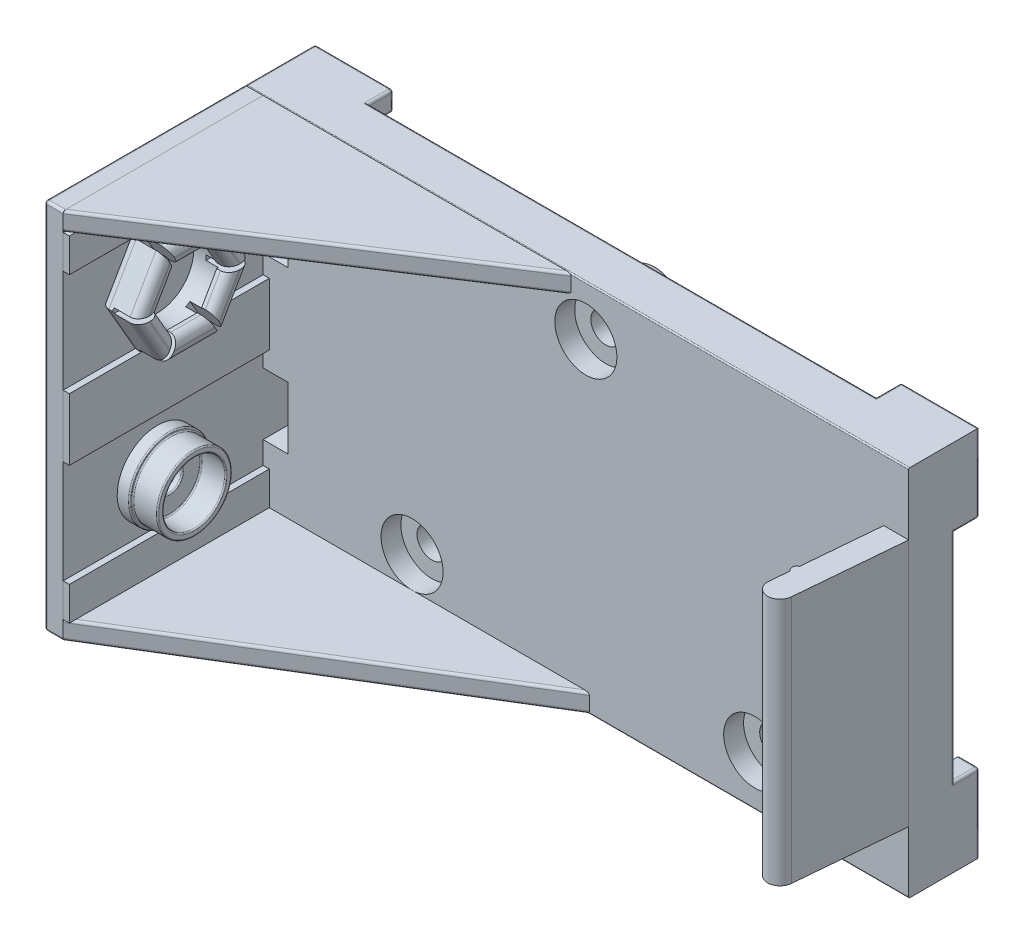
from build123d import *

# Parameters (mm, degrees)
IZIM3_W                                  = 53.5
IZIM3_H                                  = 30
Y_KSEKLIK_EKSTR_ZYON1_DEPTH              = 3.7
Y_KSEKLIK_EKSTR_ZYON2_DEPTH              = 2
IZIM5_W                                  = 1.5
IZIM5_H                                  = 30
Y_KSEKLIK_EKSTR_ZYON3_DEPTH              = 16.1
Y_KSEKLIK_EKSTR_ZYON4_DEPTH              = 1.5
Y_KSEKLIK_EKSTR_ZYON6_DEPTH              = 1.5
Y_KSEKLIK_EKSTR_ZYON9_DEPTH              = 30
IZIM9_W                                  = 10.662770755
IZIM9_H                                  = 5
IZIM9_W_2                                = 11.407729848
KES_EKSTR_ZYON1_DEPTH                    = 10
IZIM10_R                                 = 3.8
KES_EKSTR_ZYON2_DEPTH                    = 0.5
IZIM11_R                                 = 1
KES_EKSTR_ZYON3_DEPTH                    = 3
M2_YASS_BA_L_MAKINE_VIDAS_IN_HAV_2_COUNT = 2
M2_YASS_BA_L_MAKINE_VIDAS_IN_HAV_2_PITCH = 25.864261057
M2_YASS_BA_L_MAKINE_VIDAS_IN_HAV_3_COUNT = 2
M2_YASS_BA_L_MAKINE_VIDAS_IN_HAV_3_PITCH = 26.076809621
IZIM14_R                                 = 2.4
IZIM14_R_2                               = 1.2
Y_KSEKLIK_EKSTR_ZYON10_DEPTH             = 2
RADYUS2_R                                = 0.5
Y_KSEKLIK_EKSTR_ZYON13_DEPTH             = 16.1
IZIM17_W                                 = 0.5
IZIM17_H                                 = 2.7
Y_KSEKLIK_EKSTR_ZYON16_DEPTH             = 16.1
Y_KSEKLIK_EKSTR_ZYON16_2_DEPTH           = 16.1
IZIM18_R                                 = 3.25
Y_KSEKLIK_EKSTR_ZYON17_DEPTH             = 1
IZIM19_R                                 = 3
IZIM19_R_2                               = 2.5
Y_KSEKLIK_EKSTR_ZYON19_DEPTH             = 2
IZIM20_R                                 = 1
KES_EKSTR_ZYON4_DEPTH                    = 4
RADYUS3_R                                = 0.1
IZIM22_W                                 = 2
IZIM22_H                                 = 5
KES_EKSTR_ZYON5_DEPTH                    = 4
Y_KSEKLIK_EKSTR_ZYON20_DEPTH             = 3
RADYUS4_R                                = 0.7
IZIM24_R                                 = 2.907569444
IZIM24_R_2                               = 2.181093345
KES_EKSTR_ZYON7_DEPTH                    = 2
RADYUS5_R                                = 0.2
RADYUS6_R                                = 0.2
RADYUS7_R                                = 0.2
RADYUS8_R                                = 0.2
RADYUS9_R                                = 0.2
RADYUS10_R                               = 0.2
RADYUS11_R                               = 0.2
RADYUS12_R                               = 0.2
RADYUS14_R                               = 0.1
IZIM25_R                                 = 2.993779038
IZIM25_R_2                               = 1
Y_KSEKLIK_EKSTR_ZYON22_DEPTH             = 0.001
IZIM26_R                                 = 3.8
IZIM26_R_2                               = 1
Y_KSEKLIK_EKSTR_ZYON23_DEPTH             = 0.001
KES_EKSTR_ZYON10_DEPTH                   = 2
Y_KSEKLIK_EKSTR_ZYON25_DEPTH             = 0.3
Y_KSEKLIK_EKSTR_ZYON25_DEPTH_BACK        = 1
Y_KSEKLIK_EKSTR_ZYON25_2_DEPTH           = 0.3
Y_KSEKLIK_EKSTR_ZYON25_2_DEPTH_BACK      = 1
IZIM28_W                                 = 1.443802859
IZIM28_H                                 = 1
Y_KSEKLIK_EKSTR_ZYON25_3_DEPTH           = 0.3
Y_KSEKLIK_EKSTR_ZYON25_3_DEPTH_BACK      = 1
Y_KSEKLIK_EKSTR_ZYON25_4_DEPTH           = 0.3
Y_KSEKLIK_EKSTR_ZYON25_4_DEPTH_BACK      = 1
Y_KSEKLIK_EKSTR_ZYON25_5_DEPTH           = 0.3
Y_KSEKLIK_EKSTR_ZYON25_5_DEPTH_BACK      = 1
Y_KSEKLIK_EKSTR_ZYON25_6_DEPTH           = 0.3
Y_KSEKLIK_EKSTR_ZYON25_6_DEPTH_BACK      = 1
RADYUS16_R                               = 0.5
RADYUS17_R                               = 0.5
RADYUS18_R                               = 0.5
RADYUS19_R                               = 0.5
RADYUS20_R                               = 0.5
RADYUS21_R                               = 0.5
Y_KSEKLIK_EKSTR_ZYON26_START             = -1.5
Y_KSEKLIK_EKSTR_ZYON26_OUTLINE_W         = 1.443802858
Y_KSEKLIK_EKSTR_ZYON26_OUTLINE_H         = 1
Y_KSEKLIK_EKSTR_ZYON26_DEPTH             = 1.8
RADYUS22_R                               = 0.5
RADYUS23_R                               = 0.5
RADYUS24_R                               = 0.5
RADYUS25_R                               = 0.5
RADYUS26_R                               = 0.5
RADYUS27_R                               = 0.5


# Read off the part's stored shape, not the designer's step: Yükseklik-Ekstrüzyon26
with BuildPart() as part:
    # Çizim3 → Yükseklik-Ekstrüzyon1 (new body)
    with BuildSketch(Plane.XY):
        with Locations((26.75, 15)):
            Rectangle(IZIM3_W, IZIM3_H)
    extrude(amount=Y_KSEKLIK_EKSTR_ZYON1_DEPTH)

    # Çizim4 → Yükseklik-Ekstrüzyon2 (add)
    with BuildSketch(Plane(origin=(0, 0, 0), x_dir=(-1, 0, 0), z_dir=(0, 0, -1))):
        Polygon((-53.5, 6.3), (-53.5, 0), (-47.2, 0), (-47.2, 1.6), (-51.9, 1.6), (-51.9, 6.3), align=None)
        Polygon((-6.3, 1.6), (-6.3, 0), (0, 0), (0, 6.3), (-1.6, 6.3), (-1.6, 1.6), align=None)
        Polygon((-53.5, 30), (-53.5, 23.7), (-51.9, 23.7), (-51.9, 28.4), (-47.2, 28.4), (-47.2, 30), align=None)
        Polygon((0, 30), (0, 23.7), (-1.6, 23.7), (-1.6, 28.4), (-6.3, 28.4), (-6.3, 30), align=None)
    extrude(amount=Y_KSEKLIK_EKSTR_ZYON2_DEPTH)

    # Çizim8 → Yükseklik-Ekstrüzyon9 (add)
    with BuildSketch(Plane.XZ):
        with BuildLine():
            Line((53.5, 3.7), (52.739639451, 12.390960843))
            ThreePointArc((52.739639451, 12.390960843), (51.656289179, 13.3), (50.747250022, 12.216649728))
            Line((50.747250022, 12.216649728), (50.885705596, 10.634095282))
            ThreePointArc((50.885705596, 10.634095282), (50.707183036, 10.265137703), (50.947062248, 9.932785535))
            Line((50.947062248, 9.932785535), (51.492360325, 3.7))
            Line((51.492360325, 3.7), (53.5, 3.7))
        make_face()
    extrude(amount=-Y_KSEKLIK_EKSTR_ZYON9_DEPTH)

    # Çizim9 → Kes-Ekstrüzyon1 (cut)
    with BuildSketch(Plane(origin=(53.5, 0, 0), x_dir=(0, 0, -1), z_dir=(1, 0, 0))):
        with Locations((-9.031385378, 2.5)):
            Rectangle(IZIM9_W, IZIM9_H)
        with Locations((-9.403864924, 27.5)):
            Rectangle(IZIM9_W_2, IZIM9_H)
    extrude(amount=-KES_EKSTR_ZYON1_DEPTH, mode=Mode.SUBTRACT)

    # Çizim12 → M2 Yassı Başlı Makine Vidası İçin Havşa1 (revolve, cut)
    with BuildSketch(Plane(origin=(27.5, 26, 3.7), x_dir=(0, -1, 0), z_dir=(1, 0, 0))):
        Polygon((0, 0), (0, 5.700025), (1.2, 5.700025), (1.2, 1.6), (2.5, 1.6), (2.5, 0), align=None)
    m2_yass_ba_l_makine_vidas_in_hav_a1 = revolve(axis=Axis((27.5, 26, 10.05), (0, 0, -1)), mode=Mode.SUBTRACT)

    # M2 Yass_ Ba_l_ Makine Vidas_ _in Hav 2: M2 Yassı Başlı Makine Vidası İçin Havşa1 ×2
    with Locations(*[Vector(0.5258220975375508, -0.8505945695460385, 0) * (i * M2_YASS_BA_L_MAKINE_VIDAS_IN_HAV_2_PITCH) for i in range(1, M2_YASS_BA_L_MAKINE_VIDAS_IN_HAV_2_COUNT)]):
        add(m2_yass_ba_l_makine_vidas_in_hav_a1, mode=Mode.SUBTRACT)

    # M2 Yass_ Ba_l_ Makine Vidas_ _in Hav 3: M2 Yassı Başlı Makine Vidası İçin Havşa1 ×2
    with Locations(*[Vector(-0.5368754921931593, -0.8436614877321075, 0) * (i * M2_YASS_BA_L_MAKINE_VIDAS_IN_HAV_3_PITCH) for i in range(1, M2_YASS_BA_L_MAKINE_VIDAS_IN_HAV_3_COUNT)]):
        add(m2_yass_ba_l_makine_vidas_in_hav_a1, mode=Mode.SUBTRACT)

    # Çizim14 → Yükseklik-Ekstrüzyon10 (add)
    # profile 1 of 3: a face of its own
    with BuildSketch(Plane(origin=(0, 0, 0), x_dir=(-1, 0, 0), z_dir=(0, 0, -1))):
        with Locations((-27.5, 26)):
            Circle(IZIM14_R)
        with Locations(Location((-27.5, 26, 0), (0, 0, 180))):
            Circle(IZIM14_R_2, mode=Mode.SUBTRACT)
    # profile 2 of 3: a face of its own
    with BuildSketch(Plane(origin=(0, 0, 0), x_dir=(-1, 0, 0), z_dir=(0, 0, -1))):
        with Locations((-41.1, 4)):
            Circle(IZIM14_R)
        with Locations(Location((-41.1, 4, 0), (0, 0, 180))):
            Circle(IZIM14_R_2, mode=Mode.SUBTRACT)
    # profile 3 of 3: a face of its own
    with BuildSketch(Plane(origin=(0, 0, 0), x_dir=(-1, 0, 0), z_dir=(0, 0, -1))):
        with Locations((-13.5, 4)):
            Circle(IZIM14_R)
        with Locations(Location((-13.5, 4, 0), (0, 0, 180))):
            Circle(IZIM14_R_2, mode=Mode.SUBTRACT)
    extrude(amount=Y_KSEKLIK_EKSTR_ZYON10_DEPTH)

    # Radyus2
    radyus2_edges = [part.edges().sort_by_distance(p)[0] for p in [
        (29.9, 26, -2),
        (43.5, 4, -2),
        (15.9, 4, -2),
    ]]
    fillet(radyus2_edges, radius=RADYUS2_R)

    # Çizim22 → Kes-Ekstrüzyon5 (cut)
    with BuildSketch(Plane.XY.offset(3.7)):
        with Locations((2.5, 8.5)):
            Rectangle(IZIM22_W, IZIM22_H)
        with Locations((2.5, 21.5)):
            Rectangle(IZIM22_W, IZIM22_H)
    extrude(amount=-KES_EKSTR_ZYON5_DEPTH, mode=Mode.SUBTRACT)

    # Radyus9
    radyus9_edges = [part.edges().sort_by_distance(p)[0] for p in [
        (0, 0, 0.85),
    ]]
    fillet(radyus9_edges, radius=RADYUS9_R)

    # Radyus11
    radyus11_edges = [part.edges().sort_by_distance(p)[0] for p in [
        (0, 30, 0.85),
    ]]
    fillet(radyus11_edges, radius=RADYUS11_R)

    # Radyus12
    radyus12_edges = [part.edges().sort_by_distance(p)[0] for p in [
        (3.25, 0, -2),
        (0.058578644, 0.058578644, -2),
        (0, 26.75, -2),
        (0.058578644, 29.941421356, -2),
        (47.2, 0.8, -2),
        (49.55, 1.6, -2),
        (52.7, 6.3, -2),
        (51.9, 3.95, -2),
        (47.2, 29.2, -2),
        (52.7, 23.7, -2),
        (51.9, 26.05, -2),
        (49.55, 28.4, -2),
        (1.6, 23.7, -1.15),
        (6.3, 28.4, -1),
        (6.3, 29.2, -2),
        (3.95, 28.4, -2),
        (0.8, 23.7, -2),
        (1.6, 26.05, -2),
        (6.3, 0.8, -2),
        (3.95, 1.6, -2),
        (1.6, 3.95, -2),
        (0.8, 6.3, -2),
        (0, 6.3, -1),
        (1.6, 6.3, -1.15),
        (0, 15, 0),
        (0, 23.7, -1),
        (47.2, 30, -1),
        (50.35, 30, -2),
        (53.5, 26.85, -2),
        (53.5, 23.7, -1),
        (53.5, 15, 0),
        (53.5, 6.3, -1),
        (53.5, 3.15, -2),
        (50.35, 0, -2),
        (47.2, 0, -1),
        (26.75, 0, 0),
        (6.3, 0, -1),
        (0, 3.25, -2),
        (3.25, 30, -2),
        (6.3, 30, -1),
        (26.75, 30, 0),
    ]]
    fillet(radyus12_edges, radius=RADYUS12_R)

    # Radyus14
    radyus14_edges = [part.edges().sort_by_distance(p)[0] for p in [
        (26.85, 0, 3.7),
        (0.058578644, 0.058578644, 3.7),
        (0, 15, 3.7),
        (0.058578644, 29.941421356, 3.7),
        (26.85, 30, 3.7),
    ]]
    fillet(radyus14_edges, radius=RADYUS14_R)


with BuildPart() as body_2:
    # Çizim5 → Yükseklik-Ekstrüzyon3 (new body)
    with BuildSketch(Plane.XY.offset(3.7)):
        with Locations((0.75, 15)):
            Rectangle(IZIM5_W, IZIM5_H)
    extrude(amount=Y_KSEKLIK_EKSTR_ZYON3_DEPTH)

    # Çizim10 → Kes-Ekstrüzyon2 (cut)
    with BuildSketch(Plane.ZY):
        with Locations((12.2, 8)):
            Circle(IZIM10_R)
        with Locations((12.2, 22)):
            Circle(IZIM10_R)
    extrude(amount=-KES_EKSTR_ZYON2_DEPTH, mode=Mode.SUBTRACT)

    # Çizim11 → Kes-Ekstrüzyon3 (cut)
    with BuildSketch(Plane.ZY.offset(-0.5)):
        with Locations((12.2, 8)):
            Circle(IZIM11_R)
        with Locations((12.2, 22)):
            Circle(IZIM11_R)
    extrude(amount=-KES_EKSTR_ZYON3_DEPTH, mode=Mode.SUBTRACT)

    # Radyus6
    radyus6_edges = [body_2.edges().sort_by_distance(p)[0] for p in [
        (0, 15, 19.8),
    ]]
    fillet(radyus6_edges, radius=RADYUS6_R)

    # Radyus8
    radyus8_edges = [body_2.edges().sort_by_distance(p)[0] for p in [
        (0.85, 0, 19.8),
        (0, 0, 11.65),
        (0.058578644, 0, 19.741421356),
    ]]
    fillet(radyus8_edges, radius=RADYUS8_R)

    # Radyus10
    radyus10_edges = [body_2.edges().sort_by_distance(p)[0] for p in [
        (0.85, 30, 19.8),
        (0, 30, 11.65),
        (0.058578644, 30, 19.741421356),
    ]]
    fillet(radyus10_edges, radius=RADYUS10_R)


    add(part.part)  # Yükseklik-Ekstrüzyon22 merges part


with BuildPart() as body_3:
    # Çizim6 → Yükseklik-Ekstrüzyon4 (new body)
    with BuildSketch(Plane(origin=(0, 30, 0), x_dir=(1, 0, 0), z_dir=(0, 1, 0))):
        Polygon((1.5, -19.8), (26.3, -3.7), (1.5, -3.7), align=None)
    extrude(amount=-Y_KSEKLIK_EKSTR_ZYON4_DEPTH)

    # Radyus5
    radyus5_edges = [body_3.edges().sort_by_distance(p)[0] for p in [
        (13.9, 30, 11.75),
        (13.9, 28.5, 11.75),
    ]]
    fillet(radyus5_edges, radius=RADYUS5_R)


with BuildPart() as body_4:
    # Çizim7 → Yükseklik-Ekstrüzyon6 (new body)
    with BuildSketch(Plane.XZ):
        Polygon((1.5, 19.8), (27.8, 3.7), (1.5, 3.7), align=None)
    extrude(amount=-Y_KSEKLIK_EKSTR_ZYON6_DEPTH)

    # Radyus7
    radyus7_edges = [body_4.edges().sort_by_distance(p)[0] for p in [
        (14.65, 1.5, 11.75),
        (14.65, 0, 11.75),
    ]]
    fillet(radyus7_edges, radius=RADYUS7_R)


with BuildPart() as body_5:
    # Çizim16 → Yükseklik-Ekstrüzyon13 (new body)
    with BuildSketch(Plane.XY.offset(19.8)):
        Polygon((1.5, 15), (1.5, 12.5), (2, 12.5), (2, 17.5), (1.5, 17.5), align=None)
    extrude(amount=-Y_KSEKLIK_EKSTR_ZYON13_DEPTH)


with BuildPart() as body_6:
    # Çizim17 → Yükseklik-Ekstrüzyon16 (new body)
    with BuildSketch(Plane.XY.offset(19.8)):
        with Locations((1.75, 2.85)):
            Rectangle(IZIM17_W, IZIM17_H)
    extrude(amount=-Y_KSEKLIK_EKSTR_ZYON16_DEPTH)


with BuildPart() as body_7:
    # Çizim17 → Y_kseklik-Ekstr_zyon16 2 (new body)
    with BuildSketch(Plane.XY.offset(19.8)):
        with Locations((1.75, 27.15)):
            Rectangle(IZIM17_W, IZIM17_H)
    extrude(amount=-Y_KSEKLIK_EKSTR_ZYON16_2_DEPTH)


with BuildPart() as body_8:
    # Çizim18 → Yükseklik-Ekstrüzyon17 (new body)
    with BuildSketch(Plane(origin=(1.5, 0, 0), x_dir=(0, 0, -1), z_dir=(1, 0, 0))):
        with Locations(Location((-12.2, 8, 0), (0, 0, 90))):
            Circle(IZIM18_R)
    extrude(amount=Y_KSEKLIK_EKSTR_ZYON17_DEPTH)

    # Çizim19 → Yükseklik-Ekstrüzyon19 (add)
    with BuildSketch(Plane(origin=(2.5, 0, 0), x_dir=(0, 0, -1), z_dir=(1, 0, 0))):
        with Locations(Location((-12.2, 8, 0), (0, 0, 90))):
            Circle(IZIM19_R)
        with Locations(Location((-12.2, 8, 0), (0, 0, 90))):
            Circle(IZIM19_R_2, mode=Mode.SUBTRACT)
    extrude(amount=Y_KSEKLIK_EKSTR_ZYON19_DEPTH)

    # Çizim20 → Kes-Ekstrüzyon4 (cut)
    with BuildSketch(Plane.ZY.offset(-0.5)):
        with Locations(Location((12.2, 8, 0), (0, 0, 90))):
            Circle(IZIM20_R)
    extrude(amount=-KES_EKSTR_ZYON4_DEPTH, mode=Mode.SUBTRACT)

    # Radyus3
    radyus3_edges = [body_8.edges().sort_by_distance(p)[0] for p in [
        (2.5, 7, 12.2),
        (2.5, 4.75, 12.2),
        (2.5, 5.5, 12.2),
        (4.5, 5, 12.2),
        (2.5, 5, 12.2),
        (4.5, 5.5, 12.2),
    ]]
    fillet(radyus3_edges, radius=RADYUS3_R)


with BuildPart() as body_9:
    # Çizim23 → Yükseklik-Ekstrüzyon20 (new body)
    with BuildSketch(Plane(origin=(1.5, 0, 0), x_dir=(0, 0, -1), z_dir=(1, 0, 0))):
        Polygon((-7.581197846, 22), (-9.890598923, 26), (-14.509401077, 26), (-16.818802154, 22), (-14.509401077, 18), (-9.890598923, 18), align=None)
        Polygon((-10.756624327, 24.5), (-13.643375673, 24.5), (-15.086751346, 22), (-13.643375673, 19.5), (-10.756624327, 19.5), (-9.313248654, 22), align=None, mode=Mode.SUBTRACT)
    extrude(amount=Y_KSEKLIK_EKSTR_ZYON20_DEPTH)

    # Radyus4
    radyus4_edges = [body_9.edges().sort_by_distance(p)[0] for p in [
        (4.5, 26, 12.2),
        (4.5, 24, 15.664101615),
        (4.5, 20, 15.664101615),
        (4.5, 18, 12.2),
        (4.5, 23.25, 10.034936491),
        (4.5, 24.5, 12.2),
        (4.5, 23.25, 14.365063509),
        (4.5, 20.75, 14.365063509),
        (4.5, 19.5, 12.2),
        (4.5, 20.75, 10.034936491),
        (4.5, 20, 8.735898385),
        (1.5, 18, 12.2),
        (1.5, 20, 15.664101615),
        (1.5, 24, 15.664101615),
        (4.5, 24, 8.735898385),
        (1.5, 26, 12.2),
        (1.5, 24, 8.735898385),
        (1.5, 20, 8.735898385),
    ]]
    fillet(radyus4_edges, radius=RADYUS4_R)

    # Çizim24 → Kes-Ekstrüzyon7 (cut)
    with BuildSketch(Plane(origin=(1.5, 0, 0), x_dir=(0, 0, -1), z_dir=(1, 0, 0))):
        with Locations(Location((-12.2, 22, 0), (0, 0, 90))):
            Circle(IZIM24_R)
        with Locations((-12.2, 22)):
            Circle(IZIM24_R_2, mode=Mode.SUBTRACT)
    extrude(amount=KES_EKSTR_ZYON7_DEPTH, mode=Mode.SUBTRACT)


with BuildPart() as body_2_1:
    add(body_2.part)

    add(body_9.part)  # Yükseklik-Ekstrüzyon22 merges body 9
    # Çizim25 → Yükseklik-Ekstrüzyon22 (add)
    with BuildSketch(Plane(origin=(1.5, 0, 0), x_dir=(0, 0, -1), z_dir=(1, 0, 0))):
        with Locations((-12.2, 22)):
            Circle(IZIM25_R)
        with Locations(Location((-12.2, 22, 0), (0, 0, 180))):
            Circle(IZIM25_R_2, mode=Mode.SUBTRACT)
    extrude(amount=Y_KSEKLIK_EKSTR_ZYON22_DEPTH)

    # Çizim26 → Yükseklik-Ekstrüzyon23 (add)
    with BuildSketch(Plane.ZY.offset(-0.5)):
        with Locations((12.2, 22)):
            Circle(IZIM26_R)
        with Locations((12.2, 22)):
            Circle(IZIM26_R_2, mode=Mode.SUBTRACT)
    extrude(amount=Y_KSEKLIK_EKSTR_ZYON23_DEPTH)

    # Çizim27 → Kes-Ekstrüzyon10 (cut)
    with BuildSketch(Plane(origin=(4.5, 0, 0), x_dir=(0, 0, -1), z_dir=(1, 0, 0))):
        Polygon((-13.301878882, 20.552045838), (-14.18047194, 19.030278022), (-14.047520861, 18.8), (-13.851542802, 18.8), (-12.95546872, 20.352045838), align=None)
        Polygon((-16.010511777, 22), (-15.895196771, 22.199731448), (-17.78959994, 22.199731448), (-17.78959994, 21.799731448), (-15.894886674, 21.799731448), align=None)
        Polygon((-14.294269722, 22.199731448), (-15.779726717, 22.199731448), (-15.895041723, 22), (-15.779416621, 21.799731448), (-14.294269722, 21.799731448), align=None)
        Polygon((-9.799707611, 26.56070547), (-10.527576253, 25.3), (-10.294744112, 25.3), (-10.180220075, 25.101638549), (-9.453297449, 26.36070547), align=None)
        Polygon((-8.504958277, 22), (-8.620273283, 22.199731448), (-10.59350912, 22.199731448), (-10.59350912, 21.799731448), (-8.620583379, 21.799731448), align=None)
        Polygon((-6.950817187, 22.199731448), (-8.504803229, 22.199731448), (-8.389488223, 22), (-8.505113326, 21.799731448), (-6.950817187, 21.799731448), align=None)
        Polygon((-15.895041723, 22), (-15.779726717, 22.199731448), (-15.895196771, 22.199731448), (-16.010511777, 22), (-15.894886674, 21.799731448), (-15.779416621, 21.799731448), align=None)
        Polygon((-14.047520861, 18.8), (-14.18047194, 19.030278022), (-14.238206966, 18.930278022), (-14.105255888, 18.7), (-13.909277829, 18.7), (-13.851542802, 18.8), align=None)
        Polygon((-10.527576253, 25.3), (-10.58531128, 25.2), (-10.352479139, 25.2), (-10.237955102, 25.001638549), (-10.180220075, 25.101638549), (-10.294744112, 25.3), align=None)
        Polygon((-10.352479139, 25.2), (-10.58531128, 25.2), (-11.288214934, 23.982535158), (-10.941804773, 23.782535158), (-10.237955102, 25.001638549), align=None)
        Polygon((-10.294744112, 18.7), (-10.536460069, 18.7), (-9.95080179, 17.685610106), (-9.604391629, 17.885610106), (-10.184661983, 18.890667841), align=None)
        Polygon((-8.504803229, 22.199731448), (-8.620273283, 22.199731448), (-8.504958277, 22), (-8.620583379, 21.799731448), (-8.505113326, 21.799731448), (-8.389488223, 22), align=None)
        Polygon((-14.105255888, 18.7), (-14.238206966, 18.930278022), (-15.180657615, 17.297905615), (-14.834247454, 17.097905615), (-13.909277829, 18.7), align=None)
        Polygon((-11.407853004, 20.209296838), (-10.594195096, 18.8), (-10.352479139, 18.8), (-10.24239701, 18.990667841), (-11.061442843, 20.409296838), align=None)
        Polygon((-10.352479139, 18.8), (-10.594195096, 18.8), (-10.536460069, 18.7), (-10.294744112, 18.7), (-10.184661983, 18.890667841), (-10.24239701, 18.990667841), align=None)
        Polygon((-13.628445229, 24.084941958), (-14.945371078, 26.365924437), (-14.598960916, 26.565924437), (-13.282035068, 24.284941958), align=None)
    extrude(amount=-KES_EKSTR_ZYON10_DEPTH, mode=Mode.SUBTRACT)


with BuildPart() as body_8_2:
    # Çizim28 → Yükseklik-Ekstrüzyon25 (new, two sides: drawn at the far end of the back side and taken through both)
    with BuildSketch(Plane.ZY.offset(-0.499).offset(-Y_KSEKLIK_EKSTR_ZYON25_DEPTH_BACK)):
        Polygon((13.787926833, 20.249630046), (13.066025404, 21.5), (12.2, 21), (12.921901429, 19.749630046), align=None)
    extrude(amount=Y_KSEKLIK_EKSTR_ZYON25_DEPTH + Y_KSEKLIK_EKSTR_ZYON25_DEPTH_BACK)

    # Radyus17
    radyus17_edges = [body_8_2.edges().sort_by_distance(p)[0] for p in [
        (0.849, 19.749630046, 12.921901429),
        (0.849, 20.249630046, 13.787926833),
    ]]
    fillet(radyus17_edges, radius=RADYUS17_R - 0.0001)  # a hair under: the kernel refuses the full size


with BuildPart() as body_9_2:
    # Çizim28 → Y_kseklik-Ekstr_zyon25 2 (new, two sides: drawn at the far end of the back side and taken through both)
    with BuildSketch(Plane.ZY.offset(-0.499).offset(-Y_KSEKLIK_EKSTR_ZYON25_2_DEPTH_BACK)):
        with Locations((13.787926834, 22)):
            Rectangle(IZIM28_W, IZIM28_H)
    extrude(amount=Y_KSEKLIK_EKSTR_ZYON25_2_DEPTH + Y_KSEKLIK_EKSTR_ZYON25_2_DEPTH_BACK)

    # Radyus16
    radyus16_edges = [body_9_2.edges().sort_by_distance(p)[0] for p in [
        (0.849, 21.5, 14.509828263),
        (0.849, 22.5, 14.509828263),
    ]]
    fillet(radyus16_edges, radius=RADYUS16_R - 0.0001)  # a hair under: the kernel refuses the full size


with BuildPart() as body_10:
    # Çizim28 → Y_kseklik-Ekstr_zyon25 3 (new, two sides: drawn at the far end of the back side and taken through both)
    with BuildSketch(Plane.ZY.offset(-0.499).offset(-Y_KSEKLIK_EKSTR_ZYON25_3_DEPTH_BACK)):
        Polygon((11.478098571, 19.749630046), (12.2, 21), (11.333974596, 21.5), (10.612073167, 20.249630046), align=None)
    extrude(amount=Y_KSEKLIK_EKSTR_ZYON25_3_DEPTH + Y_KSEKLIK_EKSTR_ZYON25_3_DEPTH_BACK)

    # Radyus18
    radyus18_edges = [body_10.edges().sort_by_distance(p)[0] for p in [
        (0.849, 20.249630046, 10.612073167),
        (0.849, 19.749630046, 11.478098571),
    ]]
    fillet(radyus18_edges, radius=RADYUS18_R - 0.0001)  # a hair under: the kernel refuses the full size


with BuildPart() as body_11:
    # Çizim28 → Y_kseklik-Ekstr_zyon25 4 (new, two sides: drawn at the far end of the back side and taken through both)
    with BuildSketch(Plane.ZY.offset(-0.499).offset(-Y_KSEKLIK_EKSTR_ZYON25_4_DEPTH_BACK)):
        Polygon((12.2, 23), (13.066025404, 22.5), (13.787926833, 23.750369954), (12.921901429, 24.250369954), align=None)
    extrude(amount=Y_KSEKLIK_EKSTR_ZYON25_4_DEPTH + Y_KSEKLIK_EKSTR_ZYON25_4_DEPTH_BACK)

    # Radyus21
    radyus21_edges = [body_11.edges().sort_by_distance(p)[0] for p in [
        (0.849, 23.750369954, 13.787926833),
        (0.849, 24.250369954, 12.921901429),
    ]]
    fillet(radyus21_edges, radius=RADYUS21_R - 0.0001)  # a hair under: the kernel refuses the full size


with BuildPart() as body_12:
    # Çizim28 → Y_kseklik-Ekstr_zyon25 5 (new, two sides: drawn at the far end of the back side and taken through both)
    with BuildSketch(Plane.ZY.offset(-0.499).offset(-Y_KSEKLIK_EKSTR_ZYON25_5_DEPTH_BACK)):
        with Locations((10.612073167, 22)):
            Rectangle(IZIM28_W, IZIM28_H)
    extrude(amount=Y_KSEKLIK_EKSTR_ZYON25_5_DEPTH + Y_KSEKLIK_EKSTR_ZYON25_5_DEPTH_BACK)

    # Radyus19
    radyus19_edges = [body_12.edges().sort_by_distance(p)[0] for p in [
        (0.849, 22.5, 9.890171737),
        (0.849, 21.5, 9.890171737),
    ]]
    fillet(radyus19_edges, radius=RADYUS19_R - 0.0001)  # a hair under: the kernel refuses the full size


with BuildPart() as body_13:
    # Çizim28 → Y_kseklik-Ekstr_zyon25 6 (new, two sides: drawn at the far end of the back side and taken through both)
    with BuildSketch(Plane.ZY.offset(-0.499).offset(-Y_KSEKLIK_EKSTR_ZYON25_6_DEPTH_BACK)):
        Polygon((11.333974596, 22.5), (12.2, 23), (11.478098571, 24.250369954), (10.612073167, 23.750369954), align=None)
    extrude(amount=Y_KSEKLIK_EKSTR_ZYON25_6_DEPTH + Y_KSEKLIK_EKSTR_ZYON25_6_DEPTH_BACK)

    # Radyus20
    radyus20_edges = [body_13.edges().sort_by_distance(p)[0] for p in [
        (0.849, 24.250369954, 11.478098571),
        (0.849, 23.750369954, 10.612073167),
    ]]
    fillet(radyus20_edges, radius=RADYUS20_R - 0.0001)  # a hair under: the kernel refuses the full size


with BuildPart() as body_14:
    # Yükseklik-Ekstrüzyon26 outline → Yükseklik-Ekstrüzyon26 (new body)
    with BuildSketch(Plane.ZY.offset(-0.5).offset(Y_KSEKLIK_EKSTR_ZYON26_START)):
        Polygon((12.195704029, 8.990446019), (13.061729433, 8.490446019), (13.783630862, 9.740815973), (12.917605459, 10.240815973), align=None)
        Polygon((14.505532292, 8.490446019), (13.061729433, 8.490446019), (13.059574677, 8.490446019), (13.059574677, 7.490446019), (13.061729433, 7.490446019), (14.505532292, 7.490446019), align=None)
        Polygon((11.329678625, 8.490446019), (12.195704029, 8.990446019), (11.4738026, 10.240815973), (10.607777196, 9.740815973), align=None)
        with Locations((10.607777196, 7.990446019)):
            Rectangle(Y_KSEKLIK_EKSTR_ZYON26_OUTLINE_W, Y_KSEKLIK_EKSTR_ZYON26_OUTLINE_H)
        Polygon((12.195704029, 6.990446019), (11.329678625, 7.490446019), (10.607777196, 6.240076065), (11.4738026, 5.740076065), align=None)
        Polygon((13.783630862, 6.240076065), (13.061729433, 7.490446019), (12.195704029, 6.990446019), (12.917605459, 5.740076065), align=None)
    extrude(amount=Y_KSEKLIK_EKSTR_ZYON26_DEPTH)

    # Radyus22
    radyus22_edges = [body_14.edges().sort_by_distance(p)[0] for p in [
        (1.1, 8.490446019, 14.505532292),
        (1.1, 7.490446019, 14.505532292),
    ]]
    fillet(radyus22_edges, radius=RADYUS22_R - 0.0001)  # a hair under: the kernel refuses the full size

    # Radyus23
    radyus23_edges = [body_14.edges().sort_by_distance(p)[0] for p in [
        (1.1, 10.240815973, 12.917605459),
        (1.1, 9.740815973, 13.783630862),
    ]]
    fillet(radyus23_edges, radius=RADYUS23_R - 0.0001)  # a hair under: the kernel refuses the full size

    # Radyus24
    radyus24_edges = [body_14.edges().sort_by_distance(p)[0] for p in [
        (1.1, 10.240815973, 11.4738026),
        (1.1, 9.740815973, 10.607777196),
    ]]
    fillet(radyus24_edges, radius=RADYUS24_R - 0.0001)  # a hair under: the kernel refuses the full size

    # Radyus25
    radyus25_edges = [body_14.edges().sort_by_distance(p)[0] for p in [
        (1.1, 7.490446019, 9.885875767),
        (1.1, 8.490446019, 9.885875767),
    ]]
    fillet(radyus25_edges, radius=RADYUS25_R - 0.0001)  # a hair under: the kernel refuses the full size

    # Radyus26
    radyus26_edges = [body_14.edges().sort_by_distance(p)[0] for p in [
        (1.1, 5.740076065, 11.4738026),
        (1.1, 6.240076065, 10.607777196),
    ]]
    fillet(radyus26_edges, radius=RADYUS26_R - 0.0001)  # a hair under: the kernel refuses the full size

    # Radyus27
    radyus27_edges = [body_14.edges().sort_by_distance(p)[0] for p in [
        (1.1, 6.240076065, 13.783630862),
        (1.1, 5.740076065, 12.917605459),
    ]]
    fillet(radyus27_edges, radius=RADYUS27_R - 0.0001)  # a hair under: the kernel refuses the full size


solid = Compound([body_3.part, body_4.part, body_5.part, body_6.part, body_7.part, body_8.part, body_2_1.part, body_8_2.part, body_9_2.part, body_10.part, body_11.part, body_12.part, body_13.part, body_14.part])
